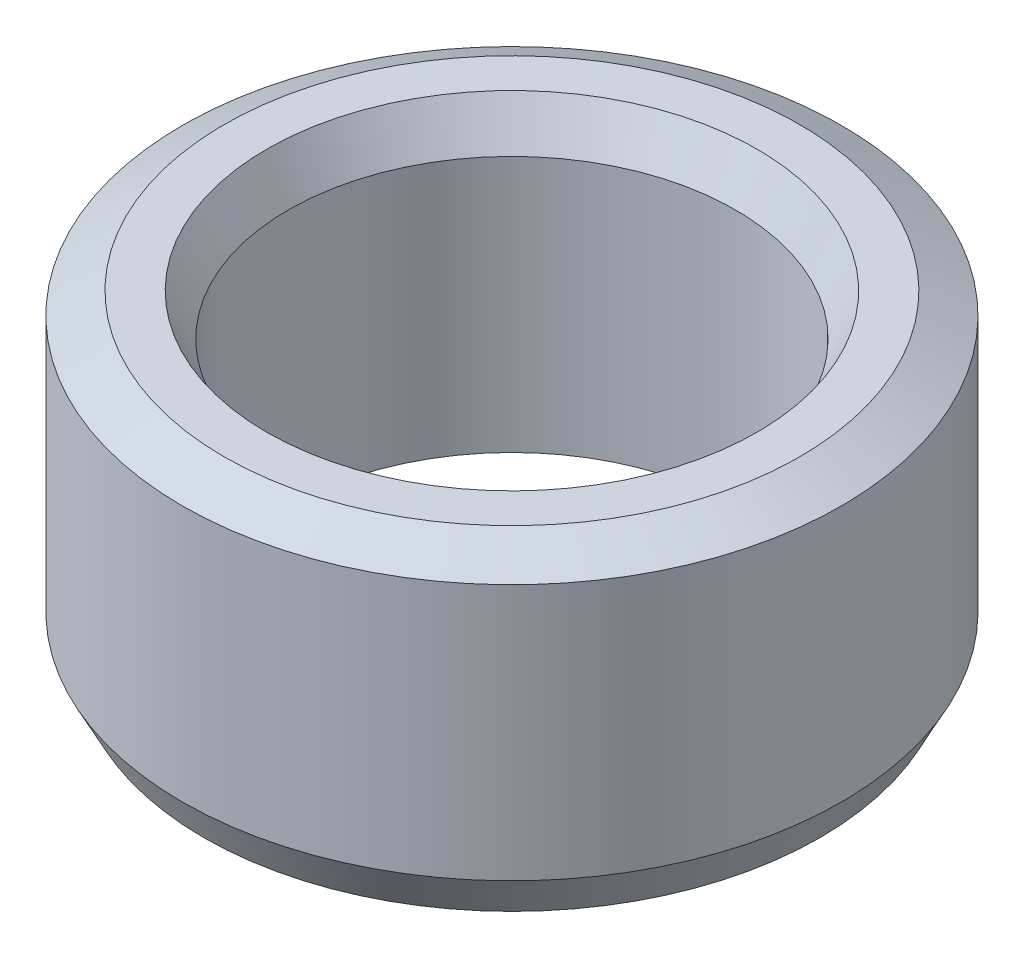
from build123d import *
from OCP.BRepFilletAPI import BRepFilletAPI_MakeChamfer

# Parameters (mm, degrees)
SKETCH1_R           = 60
BOSS_EXTRUDE1_DEPTH = 58.223085438
SKETCH2_R           = 40.702913305
CUT_EXTRUDE1_DEPTH  = 103.907374264
CHAMFER1_SIZE       = 3.9346917
CHAMFER1_SIZE2      = 7.607522921


with BuildPart() as part:
    # Sketch1 → Boss-Extrude1 (new body)
    with BuildSketch(Plane(origin=(0, 0, 0), x_dir=(1, 0, 0), z_dir=(0, 1, 0))):
        Circle(SKETCH1_R)
    extrude(amount=BOSS_EXTRUDE1_DEPTH)

    # Sketch2 → Cut-Extrude1 (cut, through all)
    with BuildSketch(Plane(origin=(0, 0, 0), x_dir=(1, 0, 0), z_dir=(0, 1, 0))):
        Circle(SKETCH2_R)
    extrude(amount=CUT_EXTRUDE1_DEPTH, mode=Mode.SUBTRACT)

    # Chamfer1: one chamfer whose edges measure the first distance from different faces: ONE call of the kernel's chamfer builder (chamfer() names one face for all edges)
    chamfer1_edges_1 = [part.edges().sort_by_distance(p)[0] for p in [
        (-40.702913305, 58.223085438, 0),
    ]]
    chamfer1_side_1 = [part.faces().sort_by_distance(p)[0] for p in [
        (-58.302943725, 58.223085438, 0),
    ]]
    chamfer1_edges_2 = [part.edges().sort_by_distance(p)[0] for p in [
        (-40.702913305, 0, 0),
    ]]
    chamfer1_side_2 = [part.faces().sort_by_distance(p)[0] for p in [
        (-40.702913305, 29.111542719, 0),
    ]]
    chamfer1_edges_3 = [part.edges().sort_by_distance(p)[0] for p in [
        (-60, 0, 0),
    ]]
    chamfer1_side_3 = [part.faces().sort_by_distance(p)[0] for p in [
        (-58.302943725, 0, 0),
    ]]
    chamfer1_edges_4 = [part.edges().sort_by_distance(p)[0] for p in [
        (-60, 58.223085438, 0),
    ]]
    chamfer1_side_4 = [part.faces().sort_by_distance(p)[0] for p in [
        (-60, 29.111542719, 0),
    ]]
    chamfer1 = BRepFilletAPI_MakeChamfer(part.part.solid().wrapped)
    for e in chamfer1_edges_1:
        chamfer1.Add(CHAMFER1_SIZE, CHAMFER1_SIZE2, e.wrapped, chamfer1_side_1[0].wrapped)  # the first distance lies on this face
    for e in chamfer1_edges_2:
        chamfer1.Add(CHAMFER1_SIZE, CHAMFER1_SIZE2, e.wrapped, chamfer1_side_2[0].wrapped)  # the first distance lies on this face
    for e in chamfer1_edges_3:
        chamfer1.Add(CHAMFER1_SIZE, CHAMFER1_SIZE2, e.wrapped, chamfer1_side_3[0].wrapped)  # the first distance lies on this face
    for e in chamfer1_edges_4:
        chamfer1.Add(CHAMFER1_SIZE, CHAMFER1_SIZE2, e.wrapped, chamfer1_side_4[0].wrapped)  # the first distance lies on this face
    add(Compound.cast(chamfer1.Shape()), mode=Mode.REPLACE)


solid = part.part
